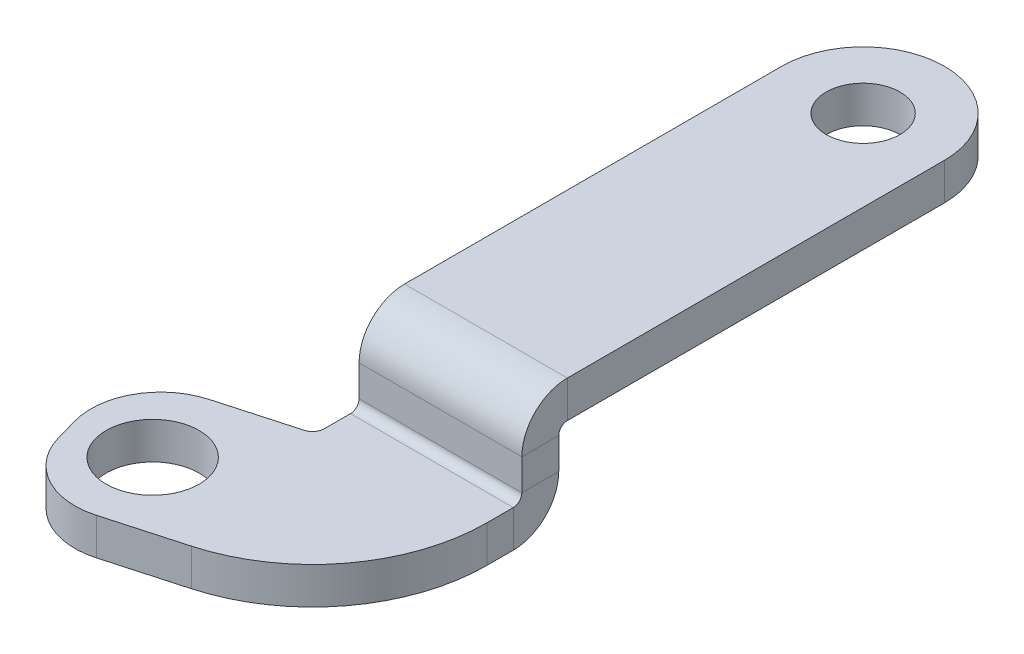
from build123d import *

# Parameters (mm, degrees)
SKETCH1_R                    = 4
BASE_FLANGE1_DEPTH           = 3.175
EDGE_FLANGE1_STRIP_W         = 14.1732
EDGE_FLANGE1_STRIP_H         = 3.175
EDGE_FLANGE1_STRIP_CUT_DEPTH = 14
EDGE_FLANGE1_DEPTH           = 14
EDGE_FLANGE2_STRIP_W         = 14.1732
EDGE_FLANGE2_STRIP_H         = 3.175
EDGE_FLANGE2_STRIP_CUT_DEPTH = 14
EDGE_FLANGE2_DEPTH           = 14
SKETCH17_R                   = 3.175
CUT_EXTRUDE1_DEPTH           = 3.175


# Sheet-metal steps are written as plain solids
with BuildPart() as part:
    # Sketch1 → Base-Flange1 (new body)
    with BuildSketch(Plane(origin=(0, 0, 0), x_dir=(1, 0, 0), z_dir=(0, 1, 0))):
        with BuildLine():
            Line((19.250001318, 12.5), (5.250001318, 12.5))
            Line((5.250001318, 12.5), (5.250001318, 9.5))
            ThreePointArc((5.250001318, 9.5), (5.046855339, 8.895828112), (4.519953978, 8.537126404))
            Line((4.519953978, 8.537126404), (-1.889668619, 6.740115171))
            ThreePointArc((-1.889668619, 6.740115171), (-5.500391492, 3.902688152), (-6.047194235, -0.656842363))
            Line((-6.047194235, -0.656842363), (-5.507288915, -2.582589555))
            ThreePointArc((-5.507288915, -2.582589555), (-2.669861896, -6.193312428), (1.889668619, -6.740115171))
            Line((1.889668619, -6.740115171), (8.299291215, -4.943103937))
            ThreePointArc((8.299291215, -4.943103937), (16.202811625, 0.437421682), (19.250001318, 9.5))
            Line((19.250001318, 9.5), (19.250001318, 12.5))
        make_face()
        with Locations(Location((0, 0, 0), (0, 0, 270))):
            Circle(SKETCH1_R, mode=Mode.SUBTRACT)
    extrude(amount=-BASE_FLANGE1_DEPTH)

    # Edge-Flange1 strip (across the edge) → Edge-Flange1 strip cut (cut)
    with BuildSketch(Plane(origin=(19.250001318, 0, -12.5), x_dir=(0, 0, 1), z_dir=(-1, 0, 0))):
        with Locations((-6.35, -1.5875)):
            Rectangle(EDGE_FLANGE1_STRIP_W, EDGE_FLANGE1_STRIP_H)
    extrude(amount=EDGE_FLANGE1_STRIP_CUT_DEPTH, mode=Mode.SUBTRACT)

    # Edge-Flange1 section (across the edge) → Edge-Flange1 (add)
    with BuildSketch(Plane(origin=(19.250001318, 0, -12.5), x_dir=(0, 0, 1), z_dir=(-1, 0, 0))):
        with BuildLine():
            Line((-3.175, 0.7366), (-3.175, 7.324994814))
            Line((-3.175, 7.324994814), (0, 7.324994814))
            Line((0, 7.324994814), (0, 0.7366))
            ThreePointArc((0, 0.7366), (0.215745145, 0.215745145), (0.7366, 0))
            Line((0.7366, 0), (0.7366, -3.175))
            ThreePointArc((0.7366, -3.175), (-2.029318885, -2.029318885), (-3.175, 0.7366))
        make_face()
    extrude(amount=EDGE_FLANGE1_DEPTH)

    # Edge-Flange2 strip (across the edge) → Edge-Flange2 strip cut (cut)
    with BuildSketch(Plane(origin=(5.250001318, 7.324994814, -15.675), x_dir=(0, -1, 0), z_dir=(1, 0, 0))):
        with Locations((-3.175, -1.5875)):
            Rectangle(EDGE_FLANGE2_STRIP_W, EDGE_FLANGE2_STRIP_H)
    extrude(amount=EDGE_FLANGE2_STRIP_CUT_DEPTH, mode=Mode.SUBTRACT)

    # Edge-Flange2 section (across the edge) → Edge-Flange2 (add)
    with BuildSketch(Plane(origin=(5.250001318, 7.324994814, -15.675), x_dir=(0, -1, 0), z_dir=(1, 0, 0))):
        with BuildLine():
            Line((0, 0.7366), (0, 40.174998631))
            Line((0, 40.174998631), (3.175, 40.174998631))
            Line((3.175, 40.174998631), (3.175, 0.7366))
            ThreePointArc((3.175, 0.7366), (3.390745145, 0.215745145), (3.9116, 0))
            Line((3.9116, 0), (3.9116, -3.175))
            ThreePointArc((3.9116, -3.175), (1.145681115, -2.029318885), (0, 0.7366))
        make_face()
    extrude(amount=EDGE_FLANGE2_DEPTH)

    # Sketch17 → Cut-Extrude1 (cut)
    with BuildSketch(Plane(origin=(0, 7.324994814, 0), x_dir=(1, 0, 0), z_dir=(0, 1, 0))):
        with BuildLine():
            ThreePointArc((5.250001318, 48.849998631), (7.30025385, 53.7997461), (12.250001318, 55.849998631))
            Line((12.250001318, 55.849998631), (5.250001318, 55.849998631))
            Line((5.250001318, 55.849998631), (5.250001318, 48.849998631))
        make_face()
        with BuildLine():
            ThreePointArc((12.250001318, 55.849998631), (17.199748787, 53.7997461), (19.250001318, 48.849998631))
            Line((19.250001318, 48.849998631), (19.250001318, 55.849998631))
            Line((19.250001318, 55.849998631), (12.250001318, 55.849998631))
        make_face()
        with Locations(Location((12.250001318, 48.849998631, 0), (0, 0, 270))):
            Circle(SKETCH17_R)
    extrude(amount=-CUT_EXTRUDE1_DEPTH, mode=Mode.SUBTRACT)


solid = part.part
